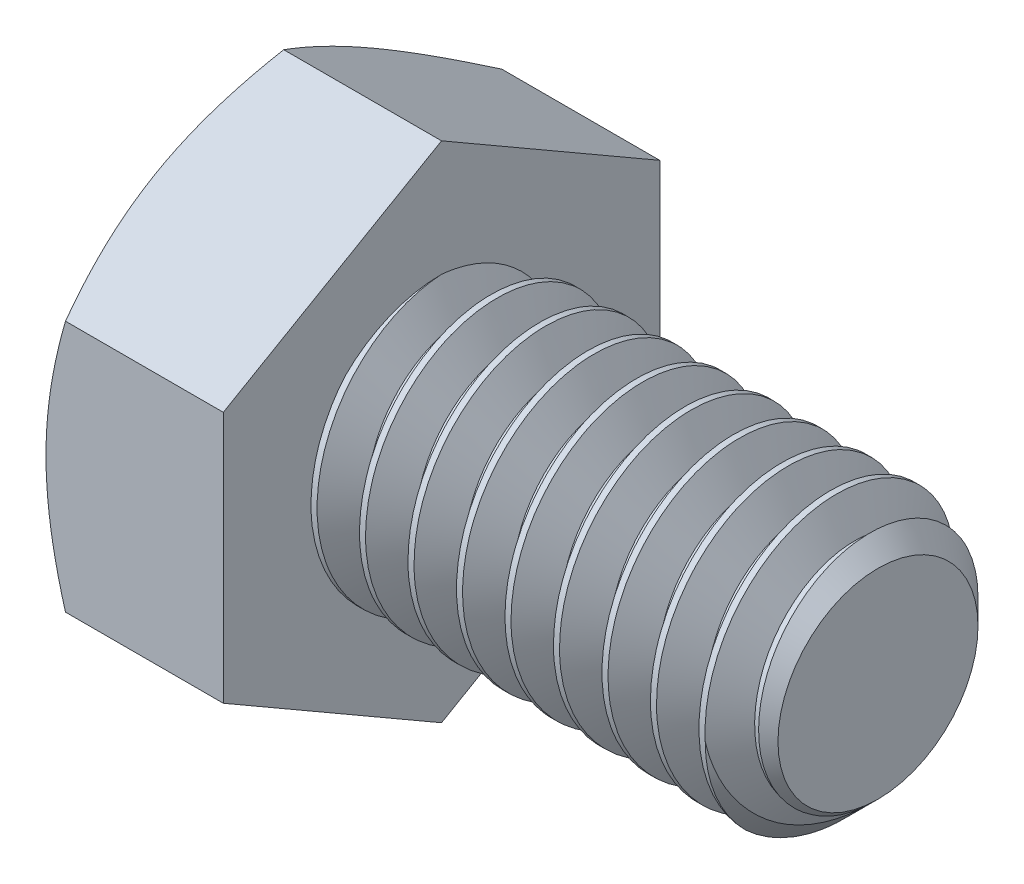
from build123d import *

# Parameters (mm, degrees)
SKETCH5_R           = 3.96875
BOSS_EXTRUDE3_DEPTH = 12.7
CHAMFER1_SIZE       = 1.058333333
CUT_SWEEP1_PITCH    = 1.411111111
BOSS_EXTRUDE4_DEPTH = 5.159375
SKETCH8_OUTSIDE_W   = 93.84
SKETCH8_OUTSIDE_H   = 95.804
SKETCH8_OUTSIDE_R   = 6.35
CUT_EXTRUDE3_DEPTH  = 21.323462181
CUT_EXTRUDE3_DRAFT  = -60


with BuildPart() as part:
    # Sketch5 → Boss-Extrude3 (new body)
    with BuildSketch(Plane(origin=(8.9296875, 0, 0), x_dir=(0, 0, -1), z_dir=(1, 0, 0))):
        Circle(SKETCH5_R)
    extrude(amount=-BOSS_EXTRUDE3_DEPTH)

    # Chamfer1
    chamfer1_edges = [part.edges().sort_by_distance(p)[0] for p in [
        (8.9296875, 0, 3.96875),
    ]]
    chamfer(chamfer1_edges, length=CHAMFER1_SIZE)

    # Cut-Sweep1: the profile of Sketch10 profile screwed along a right-hand helix of 10 turns, 8 arcs to a turn; built about Z, then put on its axis
    cut_sweep1_z = Axis((0, 0, 0), (0, 0, 1))
    cut_sweep1_corners = [(3.96905, 0, 0.000173205), (3.052206448, 0, -0.529166667), (3.052206448, 0, -0.705555556), (3.96905, 0, -1.234895427)]
    with BuildLine(mode=Mode.PRIVATE) as cut_sweep1_profile:
        Line(cut_sweep1_corners[0], cut_sweep1_corners[1])
        Line(cut_sweep1_corners[1], cut_sweep1_corners[2])
        Line(cut_sweep1_corners[2], cut_sweep1_corners[3])
        Line(cut_sweep1_corners[3], cut_sweep1_corners[0])
    cut_sweep1_cap = Face(cut_sweep1_profile.wire())
    cut_sweep1_turn_angles = [0, 22.5, 45, 67.5, 90, 112.5, 135, 157.5, 180, 202.5, 225, 247.5, 270, 292.5, 315, 337.5, 360]
    cut_sweep1_turn_weights = [1, 0.9238795325112867, 1, 0.9238795325112867, 1, 0.9238795325112867, 1, 0.9238795325112867, 1, 0.9238795325112867, 1, 0.9238795325112867, 1, 0.9238795325112867, 1, 0.9238795325112867, 1]
    cut_sweep1_turn_rails = [Edge.make_bspline([Vector(p[0], p[1], 0).rotate(cut_sweep1_z, cut_sweep1_turn_angles[k]) / cut_sweep1_turn_weights[k] + Vector(0, 0, p[2] + CUT_SWEEP1_PITCH * cut_sweep1_turn_angles[k] / 360) for k in range(17)], [0, 0, 0, 1, 1, 2, 2, 3, 3, 4, 4, 5, 5, 6, 6, 7, 7, 8, 8, 8], 2, cut_sweep1_turn_weights) for p in cut_sweep1_corners]
    cut_sweep1_turn_sides = [Face.make_surface_from_curves(cut_sweep1_turn_rails[p[0]], cut_sweep1_turn_rails[p[1]]) for p in [(0, 1), (1, 2), (2, 3), (3, 0)]]
    cut_sweep1 = Plane(origin=(8.9296875, 0, 0), x_dir=(0, 1, 0), z_dir=(-1, 0, 0)) * Solid(Shell([*[p.moved(Location((0, 0, CUT_SWEEP1_PITCH * i))) for i in range(10) for p in cut_sweep1_turn_sides], cut_sweep1_cap, cut_sweep1_cap.rotate(cut_sweep1_z, 3600).moved(Location((0, 0, CUT_SWEEP1_PITCH * 3600 / 360)))]))
    add(cut_sweep1, mode=Mode.SUBTRACT)

    # Sketch6 → Boss-Extrude4 (add)
    with BuildSketch(Plane.ZY.offset(3.7703125)):
        Polygon((6.35, 3.666174209), (0, 7.332348419), (-6.35, 3.666174209), (-6.35, -3.666174209), (0, -7.332348419), (6.35, -3.666174209), align=None)
    extrude(amount=BOSS_EXTRUDE4_DEPTH)


with BuildPart() as cut_extrude3_tool:
    # Sketch8 outside → Cut-Extrude3 (with draft: the straight prism first)
    with BuildSketch(Plane.ZY.offset(8.9296875)):
        Rectangle(SKETCH8_OUTSIDE_W, SKETCH8_OUTSIDE_H)
        Circle(SKETCH8_OUTSIDE_R, mode=Mode.SUBTRACT)
    extrude(amount=-CUT_EXTRUDE3_DEPTH)
    # Cut-Extrude3: the draft: its side faces are tilted about the plane it starts from
    cut_extrude3_sides = [cut_extrude3_tool.faces().sort_by_distance(p)[0] for p in [
        (1.732043591, -47.902, 0),
        (1.732043591, 0, 46.92),
        (1.732043591, 47.902, 0),
        (1.732043591, 0, -46.92),
        (1.732043591, 0, -6.35),
    ]]
    draft(cut_extrude3_sides, Plane.ZY.offset(8.9296875), CUT_EXTRUDE3_DRAFT)


with BuildPart() as part_1:
    add(part.part)

    # Cut-Extrude3: cut by cut_extrude3_tool
    add(cut_extrude3_tool.part, mode=Mode.SUBTRACT)


solid = part_1.part
